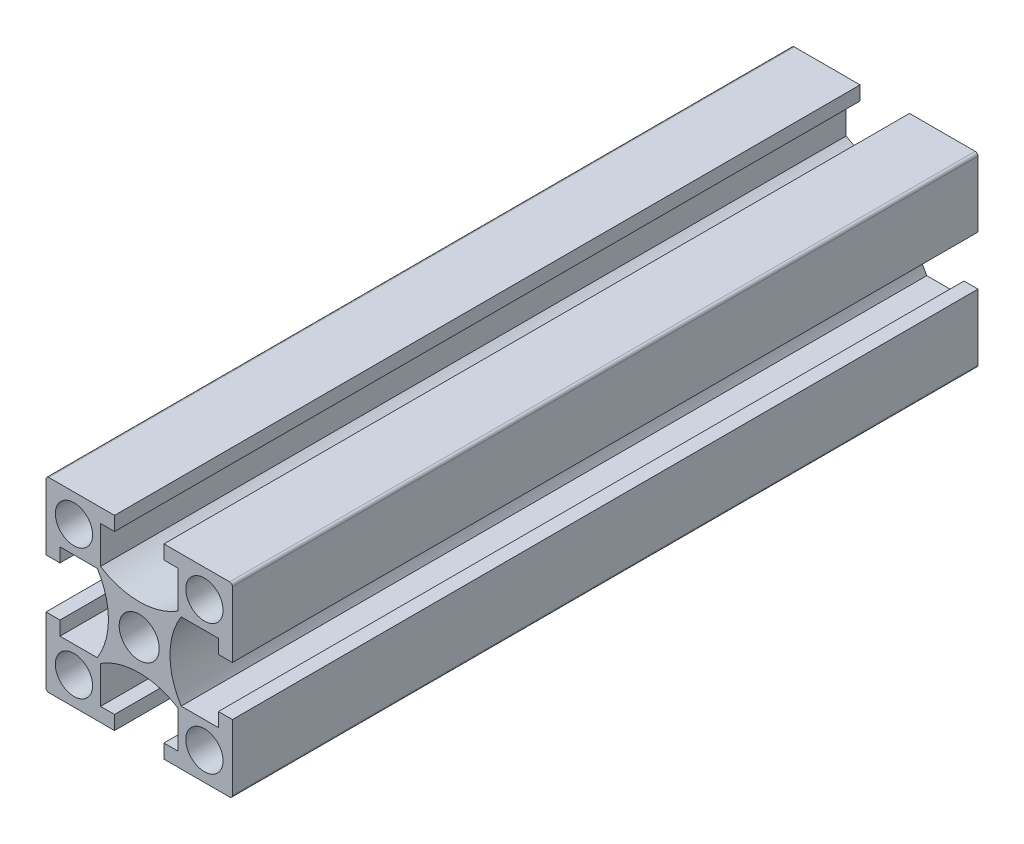
from build123d import *

# Parameters (mm, degrees)
SKETCH_1_W               = 20
SKETCH_1_H               = 20
SKETCH_1_R               = 2
SKETCH_1_R_2             = 2.15
EXTRUDE_1_DEPTH          = 80
CUT_EXTRUDE_1_REACH      = 83.24
PATTERN_CIRCULAR_1_COUNT = 4
FILLET_1_R               = 0.3
SKETCH_3_R               = 2.5
CUT_EXTRUDE_2_DEPTH      = 84.066238629


with BuildPart() as part:
    # 스케치1 → 보스-돌출1 (new body)
    with BuildSketch(Plane.XY):
        Rectangle(SKETCH_1_W, SKETCH_1_H)
        with Locations((-7, -7)):
            Circle(SKETCH_1_R, mode=Mode.SUBTRACT)
        with Locations((7, -7)):
            Circle(SKETCH_1_R, mode=Mode.SUBTRACT)
        with Locations((-7, 7)):
            Circle(SKETCH_1_R, mode=Mode.SUBTRACT)
        Circle(SKETCH_1_R_2, mode=Mode.SUBTRACT)
        with Locations((7, 7)):
            Circle(SKETCH_1_R, mode=Mode.SUBTRACT)
    extrude(amount=EXTRUDE_1_DEPTH)

    # 스케치1<3> → 컷-돌출1 (cut, up to next)
    with BuildSketch(Plane.XY, mode=Mode.PRIVATE) as cut_extrude_1_sk1:
        with BuildLine():
            Line((-8.5, 2.65), (-10, 2.65))
            Line((-10, 2.65), (-10, -2.65))
            Line((-10, -2.65), (-8.5, -2.65))
            Line((-8.5, -2.65), (-8.5, -4.15))
            Line((-8.5, -4.15), (-4.503166667, -4.15))
            ThreePointArc((-4.503166667, -4.15), (-3.3, 0), (-4.503166667, 4.15))
            Line((-4.503166667, 4.15), (-8.5, 4.15))
            Line((-8.5, 4.15), (-8.5, 2.65))
        make_face()
    cut_extrude_1_tool1 = extrude(cut_extrude_1_sk1.sketch, amount=CUT_EXTRUDE_1_REACH, mode=Mode.PRIVATE) & part.part
    cut_extrude_1 = cut_extrude_1_tool1.solids().sort_by_distance((-6.606913, 0, 0))[0]
    add(cut_extrude_1, mode=Mode.SUBTRACT)

    # 원형 패턴1: 컷-돌출1 ×4 about axis
    pattern_circular_1_axis = Axis((0, 0, 80), (0, 0, -1))
    for i in range(1, PATTERN_CIRCULAR_1_COUNT):
        add(cut_extrude_1.rotate(pattern_circular_1_axis, i * 360 / PATTERN_CIRCULAR_1_COUNT), mode=Mode.SUBTRACT)

    # 필렛1
    fillet_1_edges = [part.edges().sort_by_distance(p)[0] for p in [
        (10, -10, 40),
        (-10, -10, 40),
        (-10, 10, 40),
        (10, 10, 40),
    ]]
    fillet(fillet_1_edges, radius=FILLET_1_R)

    # 스케치3 → 컷-돌출2 (cut, through all)
    with BuildSketch(Plane.XZ.offset(10)):
        with Locations((0, 70)):
            Circle(SKETCH_3_R)
        with Locations((0, 11)):
            Circle(SKETCH_3_R)
    extrude(amount=-CUT_EXTRUDE_2_DEPTH, mode=Mode.SUBTRACT)


solid = part.part
